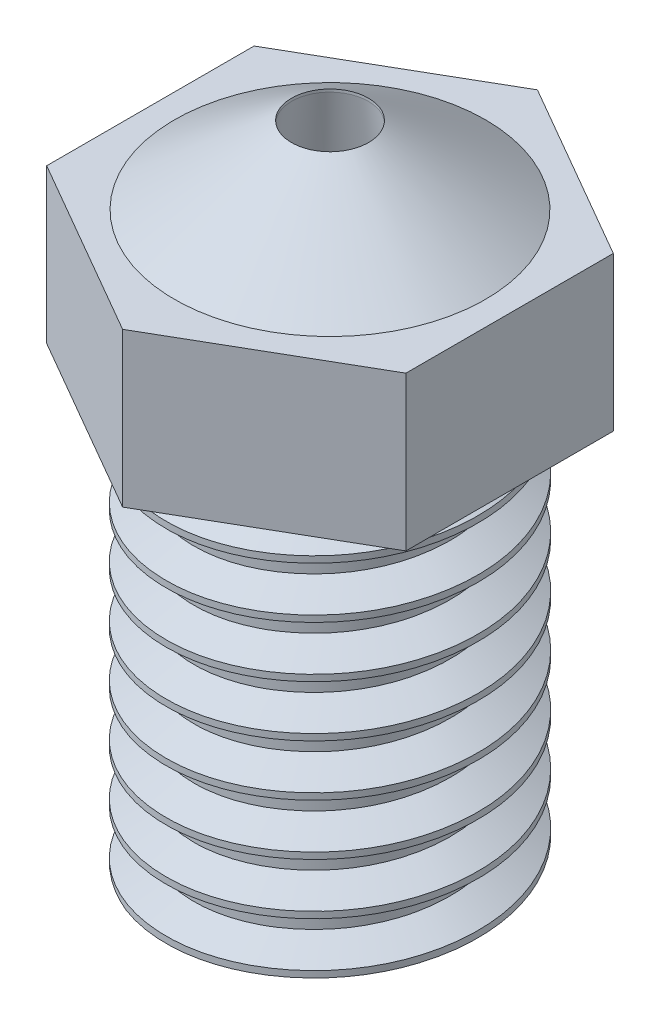
from build123d import *

# Parameters (mm, degrees)
SKETCH1_R             = 2.5
BOSS_EXTRUDE1_DEPTH   = 8
BOSS_EXTRUDE2_DEPTH   = 3
SKETCH11_R            = 0.75
CUT_EXTRUDE1_DEPTH    = 15.056433877
THREAD1_PITCH         = 1
THREAD1_FROM          = 1
ESBO_O1_R             = 2.5
CORTE_EXTRUS_O1_DEPTH = 14.600057708
CORTE_EXTRUS_O1_DRAFT = -8


with BuildPart() as part:
    # Sketch1 → Boss-Extrude1 (new body)
    with BuildSketch(Plane(origin=(0, 0, 0), x_dir=(1, 0, 0), z_dir=(0, 1, 0))):
        with Locations(Location((0, 0, 0), (0, 0, 270))):
            Circle(SKETCH1_R)
    extrude(amount=BOSS_EXTRUDE1_DEPTH)

    # Sketch9 → Boss-Extrude2 (add)
    with BuildSketch(Plane(origin=(0, 8, 0), x_dir=(1, 0, 0), z_dir=(0, 1, 0))):
        Polygon((3.5, 2.020725942), (0, 4.041451884), (-3.5, 2.020725942), (-3.5, -2.020725942), (0, -4.041451884), (3.5, -2.020725942), align=None)
    extrude(amount=BOSS_EXTRUDE2_DEPTH)

    # Sketch10 → Revolve1 (revolve)
    with BuildSketch(Plane(origin=(0, 0, 0), x_dir=(0, 0, -1), z_dir=(1, 0, 0))):
        Polygon((0, 13), (3.031088913, 11), (0, 11), align=None)
    revolve(axis=Axis((0, 11, 0), (0, 1, 0)))

    # Sketch11 → Cut-Extrude1 (cut, through all)
    with BuildSketch(Plane.XZ):
        with Locations(Location((0, 0, 0), (0, 0, 270))):
            Circle(SKETCH11_R)
    extrude(amount=-CUT_EXTRUDE1_DEPTH, mode=Mode.SUBTRACT)

    # Thread1: arcs per turn and ends read off the stored shape
    # Thread1: the profile of Thread Profile2 profile screwed along a right-hand helix through 9 turns, 8 arcs to a turn; built about Z, then put on its axis
    thread1_z = Axis((0, 0, 0), (0, 0, 1))
    thread1_corners = [(2.4997, 0, -0.000173205), (3.041265875, 0, 0.312499999), (3.041265875, 0, 0.437499999), (2.4997, 0, 0.750173202)]
    with BuildLine(mode=Mode.PRIVATE) as thread1_profile:
        Line(thread1_corners[0], thread1_corners[1])
        Line(thread1_corners[1], thread1_corners[2])
        Line(thread1_corners[2], thread1_corners[3])
        Line(thread1_corners[3], thread1_corners[0])
    thread1_cap = Face(thread1_profile.wire())
    thread1_turn_angles = [0, 22.5, 45, 67.5, 90, 112.5, 135, 157.5, 180, 202.5, 225, 247.5, 270, 292.5, 315, 337.5, 360]
    thread1_turn_weights = [1, 0.9238795325112867, 1, 0.9238795325112867, 1, 0.9238795325112867, 1, 0.9238795325112867, 1, 0.9238795325112867, 1, 0.9238795325112867, 1, 0.9238795325112867, 1, 0.9238795325112867, 1]
    thread1_turn_rails = [Edge.make_bspline([Vector(p[0], p[1], 0).rotate(thread1_z, thread1_turn_angles[k]) / thread1_turn_weights[k] + Vector(0, 0, p[2] + THREAD1_PITCH * thread1_turn_angles[k] / 360) for k in range(17)], [0, 0, 0, 1, 1, 2, 2, 3, 3, 4, 4, 5, 5, 6, 6, 7, 7, 8, 8, 8], 2, thread1_turn_weights) for p in thread1_corners]
    thread1_turn_sides = [Face.make_surface_from_curves(thread1_turn_rails[p[0]], thread1_turn_rails[p[1]]) for p in [(0, 1), (1, 2), (2, 3), (3, 0)]]
    thread1 = Plane(origin=(0, -1, 0), x_dir=(1, 0, 0), z_dir=(0, 1, 0)) * split(Solid(Shell([*[p.moved(Location((0, 0, THREAD1_PITCH * i))) for i in range(9) for p in thread1_turn_sides], thread1_cap, thread1_cap.rotate(thread1_z, 3240).moved(Location((0, 0, THREAD1_PITCH * 3240 / 360)))])), bisect_by=Plane.XY.offset(THREAD1_FROM), keep=Keep.TOP, mode=Mode.PRIVATE)
    add(thread1)


with BuildPart() as corte_extrus_o1_tool:
    # Esboço1 → Corte-extrusão1 (with draft: the straight prism first)
    with BuildSketch(Plane.XZ):
        Circle(ESBO_O1_R)
    extrude(amount=-CORTE_EXTRUS_O1_DEPTH)
    # Corte-extrusão1: the draft: its side faces are tilted about the plane it starts from
    corte_extrus_o1_sides = [corte_extrus_o1_tool.faces().sort_by_distance(p)[0] for p in [
        (-2.5, 7.300028854, 0),
    ]]
    draft(corte_extrus_o1_sides, Plane.XZ, CORTE_EXTRUS_O1_DRAFT)


with BuildPart() as part_1:
    add(part.part)

    # Corte-extrusão1: cut by corte_extrus_o1_tool
    add(corte_extrus_o1_tool.part, mode=Mode.SUBTRACT)


solid = part_1.part
